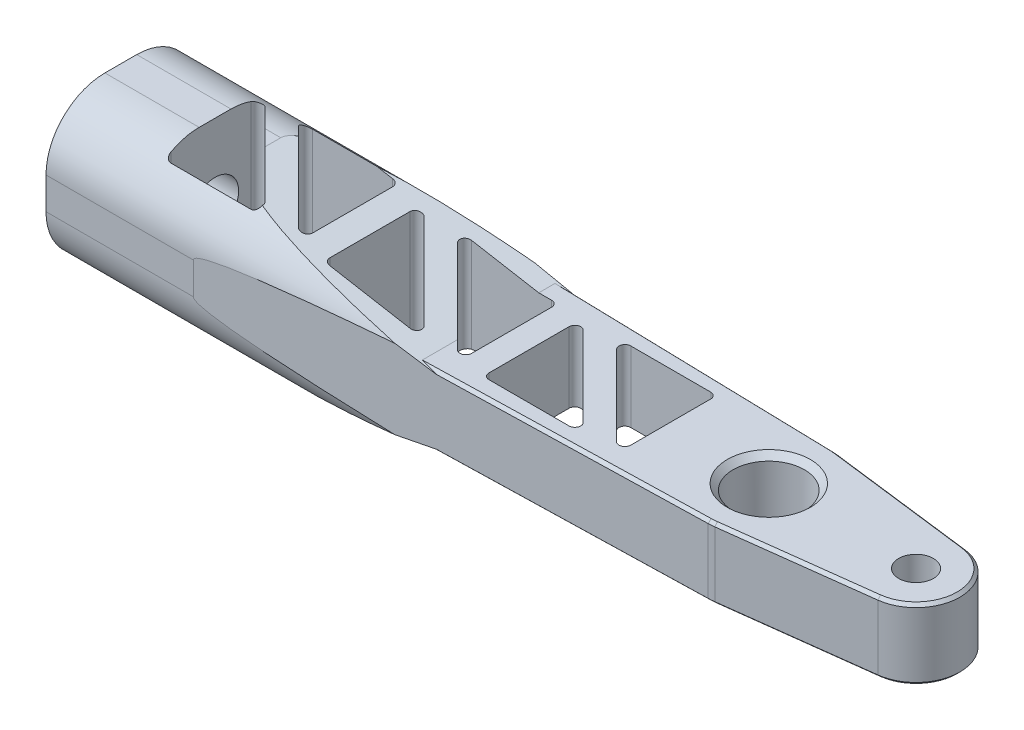
from build123d import *

# Parameters (mm, degrees)
BOSS_EXTRUDE1_DEPTH      = 12.7
BOSS_EXTRUDE1_DEPTH_BACK = 12.7
SKETCH1_R                = 2.95
SKETCH1_R_2              = 6.05
CUT_EXTRUDE4_DEPTH       = 86.079315935
CUT_EXTRUDE1_DEPTH       = 81.149563318
FILLET8_R                = 10
CUT_EXTRUDE5_DEPTH       = 81.149563318
FILLET9_R                = 1
LPATTERN1_COUNT          = 3
LPATTERN1_PITCH          = 27
FILLET9_OF_LPATTERN1_R   = 1
CHAMFER2_SIZE            = 0.5
SKETCH8_R                = 4
CUT_EXTRUDE6_DEPTH       = 18
CHAMFER3_SIZE            = 1


with BuildPart() as part:
    # Sketch1 → Boss-Extrude1 (new, two sides: drawn at the far end of the back side and taken through both)
    with BuildSketch(Plane(origin=(0, 0, 0), x_dir=(1, 0, 0), z_dir=(0, 1, 0)).offset(-BOSS_EXTRUDE1_DEPTH_BACK)):
        with BuildLine():
            Line((-67.5, -12.7), (67.5, -12.7))
            ThreePointArc((67.5, -12.7), (80.2, 0), (67.5, 12.7))
            Line((67.5, 12.7), (-67.5, 12.7))
            Line((-67.5, 12.7), (-67.5, -12.7))
        make_face()
        with Locations(Location((67.5, 0, 0), (0, 0, 270))):
            Circle(SKETCH1_R, mode=Mode.SUBTRACT)
        with Locations(Location((42.5, 0, 0), (0, 0, 270))):
            Circle(SKETCH1_R_2, mode=Mode.SUBTRACT)
    extrude(amount=BOSS_EXTRUDE1_DEPTH + BOSS_EXTRUDE1_DEPTH_BACK)

    # Sketch6 → Cut-Extrude4 (cut, through all)
    with BuildSketch(Plane(origin=(0, 12.7, 0), x_dir=(1, 0, 0), z_dir=(0, 1, 0))):
        with BuildLine():
            Line((68.4238, -7.392502524), (43.8082, -10.468577399))
            ThreePointArc((43.8082, -10.468577399), (43.288242133, -10.520512076), (42.766350508, -10.546637256))
            Line((42.766350508, -10.546637256), (-42.5, -12.7))
            Line((-42.5, -12.7), (67.5, -12.7))
            ThreePointArc((67.5, -12.7), (80.2, 0), (67.5, 12.7))
            Line((67.5, 12.7), (-42.5, 12.7))
            Line((-42.5, 12.7), (42.766350508, 10.546637256))
            ThreePointArc((42.766350508, 10.546637256), (43.288242133, 10.520512076), (43.8082, 10.468577399))
            Line((43.8082, 10.468577399), (68.4238, 7.392502524))
            ThreePointArc((68.4238, 7.392502524), (73.085016115, 4.930526848), (74.95, 0))
            ThreePointArc((74.95, 0), (73.085016115, -4.930526848), (68.4238, -7.392502524))
        make_face()
    extrude(amount=-CUT_EXTRUDE4_DEPTH, mode=Mode.SUBTRACT)

    # Sketch2 → Cut-Extrude1 (cut, through all)
    with BuildSketch(Plane(origin=(0, 0, -12.7), x_dir=(-1, 0, 0), z_dir=(0, 0, -1))):
        Polygon((-74.95, 12.7), (43.047588191, 12.7), (5.05, 6), (-74.95, 6), align=None)
        Polygon((-74.95, -12.7), (43.047588191, -12.7), (5.05, -6), (-74.95, -6), align=None)
    extrude(amount=-CUT_EXTRUDE1_DEPTH, mode=Mode.SUBTRACT)

    # Fillet8
    # the kernel refuses this fillet: 10 mm, written as the material it takes off along each edge
    with BuildSketch(Plane(origin=(-127.5, -12.7, 12.7), x_dir=(0, 1, 0), z_dir=(1, 0, 0)), Plane(origin=(16.952411809, -12.7, -12.7), x_dir=(0, 1, 0), z_dir=(-1, 0, 0))) as fillet8_piece_1:
        with BuildLine():
            CenterArc((FILLET8_R, -FILLET8_R), FILLET8_R, 90, 90)
            Line((0, -FILLET8_R), (-FILLET8_R * 0.02, -FILLET8_R))
            Line((-FILLET8_R * 0.02, -FILLET8_R), (-FILLET8_R * 0.02, FILLET8_R * 0.02))
            Line((-FILLET8_R * 0.02, FILLET8_R * 0.02), (FILLET8_R, FILLET8_R * 0.02))
            Line((FILLET8_R, FILLET8_R * 0.02), (FILLET8_R, 0))
        make_face()
    extrude(amount=144.452411809, mode=Mode.SUBTRACT)
    with BuildSketch(Plane(origin=(-127.5, 12.7, 12.7), x_dir=(0, -1, 0), z_dir=(1, 0, 0)), Plane(origin=(16.952411809, 12.7, -12.7), x_dir=(0, -1, 0), z_dir=(-1, 0, 0))) as fillet8_piece_2:
        with BuildLine():
            CenterArc((FILLET8_R, FILLET8_R), FILLET8_R, 180, 90)
            Line((0, FILLET8_R), (-FILLET8_R * 0.02, FILLET8_R))
            Line((-FILLET8_R * 0.02, FILLET8_R), (-FILLET8_R * 0.02, -FILLET8_R * 0.02))
            Line((-FILLET8_R * 0.02, -FILLET8_R * 0.02), (FILLET8_R, -FILLET8_R * 0.02))
            Line((FILLET8_R, -FILLET8_R * 0.02), (FILLET8_R, 0))
        make_face()
    extrude(amount=144.452411809, mode=Mode.SUBTRACT)

    # Sketch7 → Cut-Extrude5 (cut, through all)
    with BuildSketch(Plane(origin=(0, 12.7, 0), x_dir=(1, 0, 0), z_dir=(0, 1, 0))):
        Polygon((-51.5, 8.5), (-51.5, -8.5), (-34.5, -8.5), align=None)
        Polygon((-45.843145751, 8.5), (-28.843145751, -8.5), (-28.843145751, 8.5), align=None)
    cut_extrude5 = extrude(amount=-CUT_EXTRUDE5_DEPTH, mode=Mode.SUBTRACT)

    # Fillet9
    fillet9_edges = [part.edges().sort_by_distance(p)[0] for p in [
        (-28.843145751, 0, -8.5),
        (-45.843145751, 0, -8.5),
        (-28.843145751, 0, 8.5),
        (-34.5, 0, 8.5),
        (-51.5, 0, -8.5),
        (-51.5, 0, 8.5),
    ]]
    fillet(fillet9_edges, radius=FILLET9_R)

    # LPattern1: Cut-Extrude5 ×3
    with Locations(*[(i * LPATTERN1_PITCH, 0, 0) for i in range(1, LPATTERN1_COUNT)]):
        add(cut_extrude5, mode=Mode.SUBTRACT)

    # Fillet9 of LPattern1
    fillet9_of_lpattern1_edges = [part.edges().sort_by_distance(p)[0] for p in [
        (-1.843145751, 0, -8.5),
        (-18.843145751, 0, -8.5),
        (-1.843145751, 0, 8.5),
        (-7.5, 0, 8.5),
        (-24.5, 0, -8.5),
        (-24.5, 0, 8.5),
        (25.156854249, 0, -8.5),
        (8.156854249, 0, -8.5),
        (25.156854249, 0, 8.5),
        (19.5, 0, 8.5),
        (2.5, 0, -8.5),
        (2.5, 0, 8.5),
    ]]
    fillet(fillet9_of_lpattern1_edges, radius=FILLET9_OF_LPATTERN1_R)

    # Chamfer2
    chamfer2_edges = [part.edges().sort_by_distance(p)[0] for p in [
        (18.858175254, -6, 11.150427304),
        (56.116, -6, -8.930539961),
        (18.858175254, -6, -11.150427304),
        (43.288242133, -6, -10.520512076),
        (74.95, -6, 0),
        (43.288242133, -6, 10.520512076),
        (56.116, -6, 8.930539961),
        (56.116, 6, 8.930539961),
        (56.116, 6, -8.930539961),
        (18.858175254, 6, 11.150427304),
        (43.288242133, 6, -10.520512076),
        (18.858175254, 6, -11.150427304),
        (74.95, 6, 0),
        (43.288242133, 6, 10.520512076),
    ]]
    chamfer(chamfer2_edges, length=CHAMFER2_SIZE)

    # Sketch8 → Cut-Extrude6 (cut)
    with BuildSketch(Plane.ZY.offset(67.5)):
        Circle(SKETCH8_R)
    extrude(amount=-CUT_EXTRUDE6_DEPTH, mode=Mode.SUBTRACT)

    # Chamfer3
    chamfer3_edges = [part.edges().sort_by_distance(p)[0] for p in [
        (42.5, 6, -6.05),
    ]]
    chamfer(chamfer3_edges, length=CHAMFER3_SIZE)


solid = part.part
